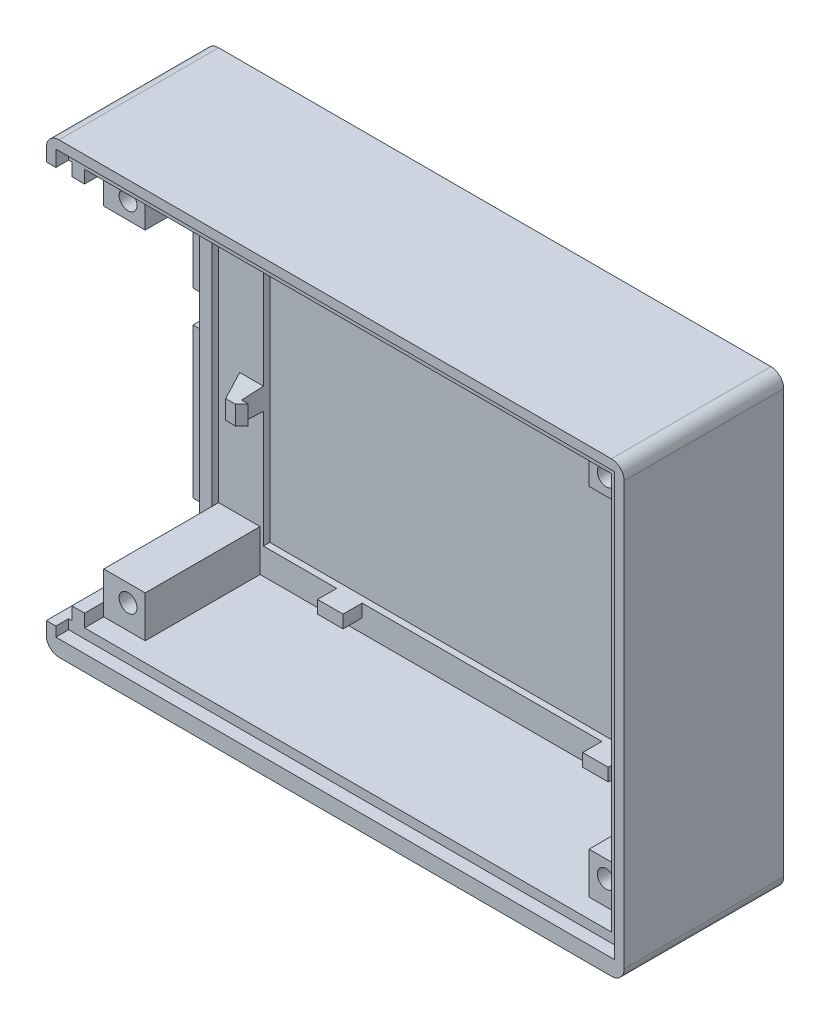
from build123d import *

# Parameters (mm, degrees)
BOSS_EXTRUDE1_DEPTH = 2
SKETCH2_W           = 6.5
SKETCH2_H           = 6.5
SKETCH2_R           = 1.4
BOSS_EXTRUDE2_DEPTH = 18
SKETCH3_W           = 68.5
SKETCH3_H           = 54
CUT_EXTRUDE1_DEPTH  = 1
SNAP_START          = 34.25
SNAP_HOOK1_DEPTH    = 2.753937008
SNAP_START_2        = 7.4782452
SNAP_HOOK1_2_DEPTH  = 3.055920826
SNAP_START_3        = 7.293382709
SNAP_HOOK1_3_DEPTH  = 3.425645808
SNAP_START_4        = 32
SNAP_HOOK1_4_DEPTH  = 7
LPATTERN1_START     = 34.25
LPATTERN1_DEPTH     = 2.753937008
LPATTERN1_START_2   = -17.740925941
LPATTERN1_2_DEPTH   = 3.56278637
LPATTERN1_START_3   = -17.487493169
LPATTERN1_3_DEPTH   = 3.055920826
LPATTERN1_START_4   = 32
LPATTERN1_4_DEPTH   = 7
SNAP_START_5        = -35.757874016
SNAP_HOOK2_DEPTH    = 1.507874016
SNAP_START_6        = -8.712249477
SNAP_HOOK2_2_DEPTH  = 3.415306745
SNAP_START_7        = -8.532556518
SNAP_HOOK2_3_DEPTH  = 3.055920826
SNAP_START_8        = -39
SNAP_HOOK2_4_DEPTH  = 7
BOSS_EXTRUDE3_START = 23
BOSS_EXTRUDE3_DEPTH = 23
SKETCH5_W           = 87.55
SKETCH5_H           = 66.23
CUT_EXTRUDE2_DEPTH  = 2
SKETCH6_W           = 2
SKETCH6_H           = 62.23
BOSS_EXTRUDE4_DEPTH = 1
SKETCH7_W           = 2
SKETCH7_H           = 3
SKETCH7_H_2         = 5
CUT_EXTRUDE3_DEPTH  = 2
SKETCH9_W           = 4
SKETCH9_H           = 2
BOSS_EXTRUDE6_DEPTH = 3


with BuildPart() as part:
    # Sketch1 → Boss-Extrude1 (new body)
    with BuildSketch(Plane.XY):
        with BuildLine():
            Line((-43.275, 35.115), (43.275, 35.115))
            ThreePointArc((43.275, 35.115), (44.689213562, 34.529213562), (45.275, 33.115))
            Line((45.275, 33.115), (45.275, -33.115))
            ThreePointArc((45.275, -33.115), (44.689213562, -34.529213562), (43.275, -35.115))
            Line((43.275, -35.115), (-43.275, -35.115))
            ThreePointArc((-43.275, -35.115), (-44.689213562, -34.529213562), (-45.275, -33.115))
            Line((-45.275, -33.115), (-45.275, 33.115))
            ThreePointArc((-45.275, 33.115), (-44.689213562, 34.529213562), (-43.275, 35.115))
        make_face()
    extrude(amount=-BOSS_EXTRUDE1_DEPTH)

    # Sketch2 → Boss-Extrude2 (add)
    # profile 1 of 4: a face of its own
    with BuildSketch(Plane.XY):
        with Locations((-38.025, -27.865)):
            Rectangle(SKETCH2_W, SKETCH2_H)
        with Locations((-37.465, -27.305)):
            Circle(SKETCH2_R, mode=Mode.SUBTRACT)
    # profile 2 of 4: a face of its own
    with BuildSketch(Plane.XY):
        with Locations((-38.025, 27.865)):
            Rectangle(SKETCH2_W, SKETCH2_H)
        with Locations((-37.465, 27.305)):
            Circle(SKETCH2_R, mode=Mode.SUBTRACT)
    # profile 3 of 4: a face of its own
    with BuildSketch(Plane.XY):
        with Locations((38.025, -27.865)):
            Rectangle(SKETCH2_W, SKETCH2_H)
        with Locations((37.465, -27.305)):
            Circle(SKETCH2_R, mode=Mode.SUBTRACT)
    # profile 4 of 4: a face of its own
    with BuildSketch(Plane.XY):
        with Locations((38.025, 27.865)):
            Rectangle(SKETCH2_W, SKETCH2_H)
        with Locations((37.465, 27.305)):
            Circle(SKETCH2_R, mode=Mode.SUBTRACT)
    extrude(amount=BOSS_EXTRUDE2_DEPTH)

    # Sketch3 → Cut-Extrude1 (cut)
    with BuildSketch(Plane.XY):
        Rectangle(SKETCH3_W, SKETCH3_H)
    extrude(amount=-CUT_EXTRUDE1_DEPTH, mode=Mode.SUBTRACT)

    # Snap Hook1: read off the stored shape, not the designer's step
    # Snap Hook1 outline → Snap Hook1 (add)
    with BuildSketch(Plane.YZ.offset(SNAP_START)):
        Polygon((10.482583566, 4.511638427), (7.52982766, 4.511638427), (7.293382709, 0), (10.719028517, 0), align=None)
    extrude(amount=SNAP_HOOK1_DEPTH)

    # Snap Hook1 2 outline → Snap Hook1 2 (add)
    with BuildSketch(Plane(origin=(0, 0, 0), x_dir=(1, 0, 0), z_dir=(0, 1, 0)).offset(SNAP_START_2)):
        Polygon((34.25, -3.527386458), (33.265748031, -3.527386458), (34.25, -4.511638427), align=None)
        Polygon((38.131846615, 0), (37.003937008, 0), (37.003937008, -4.511638427), align=None)
    extrude(amount=SNAP_HOOK1_2_DEPTH)

    # Snap Hook1 3 outline → Snap Hook1 3 (add)
    with BuildSketch(Plane(origin=(0, 0, 0), x_dir=(1, 0, 0), z_dir=(0, 1, 0)).offset(SNAP_START_3)):
        Polygon((38.131846615, 0), (37.003937008, 0), (37.003937008, -4.511638427), align=None)
    extrude(amount=SNAP_HOOK1_3_DEPTH)

    # Snap Hook1 4 outline → Snap Hook1 4 (cut)
    with BuildSketch(Plane.YZ.offset(SNAP_START_4)):
        Polygon((10.719028517, 0), (10.719028517, 6), (10.404581841, 6), (10.482583566, 4.511638427), align=None)
        Polygon((7.52982766, 4.511638427), (7.607829385, 6), (7.293382709, 6), (7.293382709, 0), align=None)
    extrude(amount=SNAP_HOOK1_4_DEPTH, mode=Mode.SUBTRACT)

    # LPattern1: read off the stored shape, not the designer's step
    # LPattern1 outline → LPattern1 (add)
    with BuildSketch(Plane.YZ.offset(LPATTERN1_START)):
        Polygon((-14.483154803, 5.820037333), (-17.435910709, 5.820037333), (-17.740925941, 0), (-14.178139571, 0), align=None)
    extrude(amount=LPATTERN1_DEPTH)

    # LPattern1 2 outline → LPattern1 2 (add)
    with BuildSketch(Plane(origin=(0, 0, 0), x_dir=(1, 0, 0), z_dir=(0, 1, 0)).offset(LPATTERN1_START_2)):
        Polygon((38.458946341, 0), (37.003937008, 0), (37.003937008, -5.820037333), align=None)
    extrude(amount=LPATTERN1_2_DEPTH)

    # LPattern1 3 outline → LPattern1 3 (add)
    with BuildSketch(Plane(origin=(0, 0, 0), x_dir=(1, 0, 0), z_dir=(0, 1, 0)).offset(LPATTERN1_START_3)):
        Polygon((34.25, -4.835785364), (33.265748031, -4.835785364), (34.25, -5.820037333), align=None)
    extrude(amount=LPATTERN1_3_DEPTH)

    # LPattern1 4 outline → LPattern1 4 (cut)
    with BuildSketch(Plane.YZ.offset(LPATTERN1_START_4)):
        Polygon((-14.178139571, 0), (-14.178139571, 7), (-14.544994026, 7), (-14.483154803, 5.820037333), align=None)
        Polygon((-17.435910709, 5.820037333), (-17.374071486, 7), (-17.740925941, 7), (-17.740925941, 0), align=None)
    extrude(amount=LPATTERN1_4_DEPTH, mode=Mode.SUBTRACT)

    # Snap Hook2: read off the stored shape, not the designer's step
    # Snap Hook2 outline → Snap Hook2 (add)
    with BuildSketch(Plane.YZ.offset(SNAP_START_5)):
        Polygon((-5.528218152, 4.412997898), (-8.480974058, 4.412997898), (-8.712249477, 0), (-5.296942732, 0), align=None)
    extrude(amount=SNAP_HOOK2_DEPTH)

    # Snap Hook2 2 outline → Snap Hook2 2 (add)
    with BuildSketch(Plane(origin=(0, 0, 0), x_dir=(1, 0, 0), z_dir=(0, 1, 0)).offset(SNAP_START_6)):
        Polygon((-35.757874016, -4.412997898), (-35.757874016, 0), (-37.964372965, 0), align=None)
    extrude(amount=SNAP_HOOK2_2_DEPTH)

    # Snap Hook2 3 outline → Snap Hook2 3 (add)
    with BuildSketch(Plane(origin=(0, 0, 0), x_dir=(1, 0, 0), z_dir=(0, 1, 0)).offset(SNAP_START_7)):
        Polygon((-34.25, -3.428745929), (-34.25, -4.412997898), (-33.265748031, -3.428745929), align=None)
    extrude(amount=SNAP_HOOK2_3_DEPTH)

    # Snap Hook2 4 outline → Snap Hook2 4 (cut)
    with BuildSketch(Plane.YZ.offset(SNAP_START_8)):
        Polygon((-8.480974058, 4.412997898), (-8.397802802, 6), (-8.712249477, 6), (-8.712249477, 0), align=None)
        Polygon((-5.611389408, 6), (-5.528218152, 4.412997898), (-5.296942732, 0), (-5.296942732, 6), align=None)
    extrude(amount=SNAP_HOOK2_4_DEPTH, mode=Mode.SUBTRACT)

    # Sketch4 → Boss-Extrude3 (add)
    with BuildSketch(Plane.XY.offset(BOSS_EXTRUDE3_START)):
        with BuildLine():
            Line((-43.275, 35.115), (43.275, 35.115))
            ThreePointArc((43.275, 35.115), (44.689213562, 34.529213562), (45.275, 33.115))
            Line((45.275, 33.115), (45.275, -33.115))
            ThreePointArc((45.275, -33.115), (44.689213562, -34.529213562), (43.275, -35.115))
            Line((43.275, -35.115), (-43.275, -35.115))
            ThreePointArc((-43.275, -35.115), (-44.689213562, -34.529213562), (-45.275, -33.115))
            Line((-45.275, -33.115), (-45.275, -31.115))
            Line((-45.275, -31.115), (-43.275, -31.115))
            Line((-43.275, -31.115), (-43.275, -29.115))
            Line((-43.275, -29.115), (-41.275, -29.115))
            Line((-41.275, -29.115), (-41.275, -31.115))
            Line((-41.275, -31.115), (41.275, -31.115))
            Line((41.275, -31.115), (41.275, 31.115))
            Line((41.275, 31.115), (-41.275, 31.115))
            Line((-41.275, 31.115), (-41.275, 29.115))
            Line((-41.275, 29.115), (-43.275, 29.115))
            Line((-43.275, 29.115), (-43.275, 31.115))
            Line((-43.275, 31.115), (-45.275, 31.115))
            Line((-45.275, 31.115), (-45.275, 33.115))
            ThreePointArc((-45.275, 33.115), (-44.689213562, 34.529213562), (-43.275, 35.115))
        make_face()
    extrude(amount=-BOSS_EXTRUDE3_DEPTH)

    # Sketch5 → Cut-Extrude2 (cut)
    with BuildSketch(Plane.XY.offset(23)):
        with Locations((0, 0.5)):
            Rectangle(SKETCH5_W, SKETCH5_H)
    extrude(amount=-CUT_EXTRUDE2_DEPTH, mode=Mode.SUBTRACT)

    # Sketch6 → Boss-Extrude4 (add)
    with BuildSketch(Plane.XY):
        with Locations((-42.275, 0)):
            Rectangle(SKETCH6_W, SKETCH6_H)
    extrude(amount=BOSS_EXTRUDE4_DEPTH)

    # Sketch7 → Cut-Extrude3 (cut)
    with BuildSketch(Plane.XY):
        with Locations((-44.275, 27.5)):
            Rectangle(SKETCH7_W, SKETCH7_H)
        with Locations((-44.275, -27.5)):
            Rectangle(SKETCH7_W, SKETCH7_H)
        with Locations((-44.275, 0)):
            Rectangle(SKETCH7_W, SKETCH7_H_2)
    extrude(amount=-CUT_EXTRUDE3_DEPTH, mode=Mode.SUBTRACT)

    # Sketch9 → Boss-Extrude6 (add)
    with BuildSketch(Plane.XY):
        with Locations((20.775, 28)):
            Rectangle(SKETCH9_W, SKETCH9_H)
        with Locations((-20.775, 28)):
            Rectangle(SKETCH9_W, SKETCH9_H)
        with Locations((20.775, -28)):
            Rectangle(SKETCH9_W, SKETCH9_H)
        with Locations((-20.775, -28)):
            Rectangle(SKETCH9_W, SKETCH9_H)
    extrude(amount=BOSS_EXTRUDE6_DEPTH)


solid = part.part
